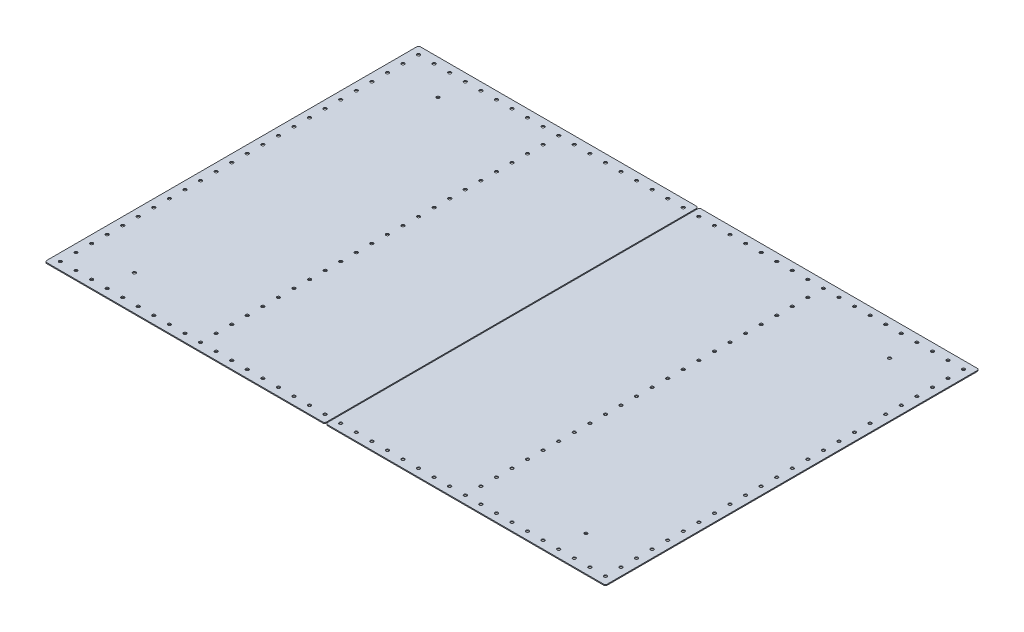
from build123d import *

# Parameters (mm, degrees)
SKETCH1_W           = 914.4
SKETCH1_H           = 609.6
BOSS_EXTRUDE1_DEPTH = 1.5875
SKETCH2_R           = 2.4892
CUT_EXTRUDE1_DEPTH  = 550.48830757
LPATTERN1_COUNT     = 24
LPATTERN1_PITCH     = 25.4
LPATTERN1_COL_COUNT = 36
LPATTERN1_COL_PITCH = 25.4
LPATTERN2_COUNT     = 23
LPATTERN2_PITCH     = 25.4
LPATTERN2_COL_COUNT = 35
LPATTERN2_COL_PITCH = 25.4
FILLET1_R           = 3.175
LPATTERN3_OUTLINE_R = 2.4892
LPATTERN3_DEPTH     = 1.5875
CUT_EXTRUDE2_REACH  = 551.488
SKETCH3_R           = 2.4892
SKETCH4_W           = 1.5875
SKETCH4_H           = 609.6
CUT_EXTRUDE3_DEPTH  = 550.48830757
FILLET2_R           = 3.175
FILLET3_R           = 3.175


# Read off the part's stored shape, not the designer's step: LPattern3
with BuildPart() as part:
    # Sketch1 → Boss-Extrude1 (new body)
    with BuildSketch(Plane(origin=(0, 0, 0), x_dir=(1, 0, 0), z_dir=(0, 1, 0))):
        Rectangle(SKETCH1_W, SKETCH1_H)
    extrude(amount=BOSS_EXTRUDE1_DEPTH)

    # Sketch2 → Cut-Extrude1 (cut, through all)
    with BuildSketch(Plane(origin=(0, 1.5875, 0), x_dir=(1, 0, 0), z_dir=(0, 1, 0))):
        with Locations(Location((-444.5, 292.1, 0), (0, 0, 270))):
            Circle(SKETCH2_R)
        with Locations(Location((444.5, -292.1, 0), (0, 0, 270))):
            Circle(SKETCH2_R)
    cut_extrude1 = extrude(amount=-CUT_EXTRUDE1_DEPTH, mode=Mode.SUBTRACT)

    # LPattern1: Cut-Extrude1 ×24
    with Locations(*[(0, 0, i * LPATTERN1_PITCH) for i in range(1, LPATTERN1_COUNT)]):
        add(cut_extrude1, mode=Mode.SUBTRACT)

    # LPattern1 col: Cut-Extrude1 ×36
    with Locations(*[(i * LPATTERN1_COL_PITCH, 0, 0) for i in range(1, LPATTERN1_COL_COUNT)]):
        add(cut_extrude1, mode=Mode.SUBTRACT)

    # LPattern2: Cut-Extrude1 ×23
    with Locations(*[(0, 0, -i * LPATTERN2_PITCH) for i in range(1, LPATTERN2_COUNT)]):
        add(cut_extrude1, mode=Mode.SUBTRACT)

    # LPattern2 col: Cut-Extrude1 ×35
    with Locations(*[(-i * LPATTERN2_COL_PITCH, 0, 0) for i in range(1, LPATTERN2_COL_COUNT)]):
        add(cut_extrude1, mode=Mode.SUBTRACT)

    # Fillet1
    fillet1_edges = [part.edges().sort_by_distance(p)[0] for p in [
        (-457.2, 0.79375, -304.8),
        (457.2, 0.79375, -304.8),
        (457.2, 0.79375, 304.8),
        (-457.2, 0.79375, 304.8),
    ]]
    fillet(fillet1_edges, radius=FILLET1_R)

    # LPattern3 outline → LPattern3 (cut)
    with BuildSketch(Plane(origin=(0, 0, 0), x_dir=(1, 0, 0), z_dir=(0, 1, 0))):
        with Locations((-215.9, 266.7)):
            Circle(LPATTERN3_OUTLINE_R)
        with Locations((215.9, 266.7)):
            Circle(LPATTERN3_OUTLINE_R)
        with Locations((-215.9, 241.3)):
            Circle(LPATTERN3_OUTLINE_R)
        with Locations((215.9, 241.3)):
            Circle(LPATTERN3_OUTLINE_R)
        with Locations((-215.9, 215.9)):
            Circle(LPATTERN3_OUTLINE_R)
        with Locations((215.9, 215.9)):
            Circle(LPATTERN3_OUTLINE_R)
        with Locations((-215.9, 190.5)):
            Circle(LPATTERN3_OUTLINE_R)
        with Locations((215.9, 190.5)):
            Circle(LPATTERN3_OUTLINE_R)
        with Locations((-215.9, 165.1)):
            Circle(LPATTERN3_OUTLINE_R)
        with Locations((215.9, 165.1)):
            Circle(LPATTERN3_OUTLINE_R)
        with Locations((-215.9, 139.7)):
            Circle(LPATTERN3_OUTLINE_R)
        with Locations((215.9, 139.7)):
            Circle(LPATTERN3_OUTLINE_R)
        with Locations((-215.9, 114.3)):
            Circle(LPATTERN3_OUTLINE_R)
        with Locations((215.9, 114.3)):
            Circle(LPATTERN3_OUTLINE_R)
        with Locations((-215.9, 88.9)):
            Circle(LPATTERN3_OUTLINE_R)
        with Locations((215.9, 88.9)):
            Circle(LPATTERN3_OUTLINE_R)
        with Locations((-215.9, 63.5)):
            Circle(LPATTERN3_OUTLINE_R)
        with Locations((215.9, 63.5)):
            Circle(LPATTERN3_OUTLINE_R)
        with Locations((-215.9, 38.1)):
            Circle(LPATTERN3_OUTLINE_R)
        with Locations((215.9, 38.1)):
            Circle(LPATTERN3_OUTLINE_R)
        with Locations((-215.9, 12.7)):
            Circle(LPATTERN3_OUTLINE_R)
        with Locations((215.9, 12.7)):
            Circle(LPATTERN3_OUTLINE_R)
        with Locations((-215.9, -12.7)):
            Circle(LPATTERN3_OUTLINE_R)
        with Locations((215.9, -12.7)):
            Circle(LPATTERN3_OUTLINE_R)
        with Locations((-215.9, -38.1)):
            Circle(LPATTERN3_OUTLINE_R)
        with Locations((215.9, -38.1)):
            Circle(LPATTERN3_OUTLINE_R)
        with Locations((-215.9, -63.5)):
            Circle(LPATTERN3_OUTLINE_R)
        with Locations((215.9, -63.5)):
            Circle(LPATTERN3_OUTLINE_R)
        with Locations((-215.9, -88.9)):
            Circle(LPATTERN3_OUTLINE_R)
        with Locations((215.9, -88.9)):
            Circle(LPATTERN3_OUTLINE_R)
        with Locations((-215.9, -114.3)):
            Circle(LPATTERN3_OUTLINE_R)
        with Locations((215.9, -114.3)):
            Circle(LPATTERN3_OUTLINE_R)
        with Locations((-215.9, -139.7)):
            Circle(LPATTERN3_OUTLINE_R)
        with Locations((215.9, -139.7)):
            Circle(LPATTERN3_OUTLINE_R)
        with Locations((-215.9, -165.1)):
            Circle(LPATTERN3_OUTLINE_R)
        with Locations((215.9, -165.1)):
            Circle(LPATTERN3_OUTLINE_R)
        with Locations((-215.9, -190.5)):
            Circle(LPATTERN3_OUTLINE_R)
        with Locations((215.9, -190.5)):
            Circle(LPATTERN3_OUTLINE_R)
        with Locations((-215.9, -215.9)):
            Circle(LPATTERN3_OUTLINE_R)
        with Locations((215.9, -215.9)):
            Circle(LPATTERN3_OUTLINE_R)
        with Locations((-215.9, -241.3)):
            Circle(LPATTERN3_OUTLINE_R)
        with Locations((215.9, -241.3)):
            Circle(LPATTERN3_OUTLINE_R)
        with Locations((-215.9, -266.7)):
            Circle(LPATTERN3_OUTLINE_R)
        with Locations((215.9, -266.7)):
            Circle(LPATTERN3_OUTLINE_R)
    extrude(amount=LPATTERN3_DEPTH, mode=Mode.SUBTRACT)

    # Sketch3 → Cut-Extrude2 (cut, up to next)
    with BuildSketch(Plane.XZ, mode=Mode.PRIVATE) as cut_extrude2_sk1:
        with Locations(Location((368.3, 247.65, 0), (0, 0, 270))):
            Circle(SKETCH3_R)
    cut_extrude2_tool1 = extrude(cut_extrude2_sk1.sketch, amount=-CUT_EXTRUDE2_REACH, mode=Mode.PRIVATE) & part.part
    # Sketch3 → Cut-Extrude2 (cut, up to next)
    with BuildSketch(Plane.XZ, mode=Mode.PRIVATE) as cut_extrude2_sk2:
        with Locations(Location((368.3, -247.65, 0), (0, 0, 270))):
            Circle(SKETCH3_R)
    cut_extrude2_tool2 = extrude(cut_extrude2_sk2.sketch, amount=-CUT_EXTRUDE2_REACH, mode=Mode.PRIVATE) & part.part
    # Sketch3 → Cut-Extrude2 (cut, up to next)
    with BuildSketch(Plane.XZ, mode=Mode.PRIVATE) as cut_extrude2_sk3:
        with Locations(Location((-368.3, -247.65, 0), (0, 0, 270))):
            Circle(SKETCH3_R)
    cut_extrude2_tool3 = extrude(cut_extrude2_sk3.sketch, amount=-CUT_EXTRUDE2_REACH, mode=Mode.PRIVATE) & part.part
    # Sketch3 → Cut-Extrude2 (cut, up to next)
    with BuildSketch(Plane.XZ, mode=Mode.PRIVATE) as cut_extrude2_sk4:
        with Locations(Location((-368.3, 247.65, 0), (0, 0, 270))):
            Circle(SKETCH3_R)
    cut_extrude2_tool4 = extrude(cut_extrude2_sk4.sketch, amount=-CUT_EXTRUDE2_REACH, mode=Mode.PRIVATE) & part.part
    add(cut_extrude2_tool1.solids().sort_by_distance((368.3, 0, 247.65))[0], mode=Mode.SUBTRACT)
    add(cut_extrude2_tool2.solids().sort_by_distance((368.3, 0, -247.65))[0], mode=Mode.SUBTRACT)
    add(cut_extrude2_tool3.solids().sort_by_distance((-368.3, 0, -247.65))[0], mode=Mode.SUBTRACT)
    add(cut_extrude2_tool4.solids().sort_by_distance((-368.3, 0, 247.65))[0], mode=Mode.SUBTRACT)

    # Sketch4 → Cut-Extrude3 (cut, through all)
    with BuildSketch(Plane(origin=(0, 1.5875, 0), x_dir=(1, 0, 0), z_dir=(0, 1, 0))):
        Rectangle(SKETCH4_W, SKETCH4_H)
    extrude(amount=-CUT_EXTRUDE3_DEPTH, mode=Mode.SUBTRACT)


with BuildPart() as cut_extrude3_piece_1:
    # of the separate pieces the step leaves, piece 1, a body of its own (cut_extrude3_pieces)
    add(part.part.solids().sort_by_distance((454.025, 0, 304.8))[0])

    # Fillet3
    fillet3_edges = [cut_extrude3_piece_1.edges().sort_by_distance(p)[0] for p in [
        (0.79375, 0.79375, -304.8),
        (0.79375, 0.79375, 304.8),
    ]]
    fillet(fillet3_edges, radius=FILLET3_R)


with BuildPart() as cut_extrude3_piece_2:
    # of the separate pieces the step leaves, piece 2, a body of its own (cut_extrude3_pieces)
    add(part.part.solids().sort_by_distance((-0.79375, 0, 304.8))[0])

    # Fillet2
    fillet2_edges = [cut_extrude3_piece_2.edges().sort_by_distance(p)[0] for p in [
        (-0.79375, 0.79375, 304.8),
        (-0.79375, 0.79375, -304.8),
    ]]
    fillet(fillet2_edges, radius=FILLET2_R)


solid = Compound([cut_extrude3_piece_1.part, cut_extrude3_piece_2.part])
